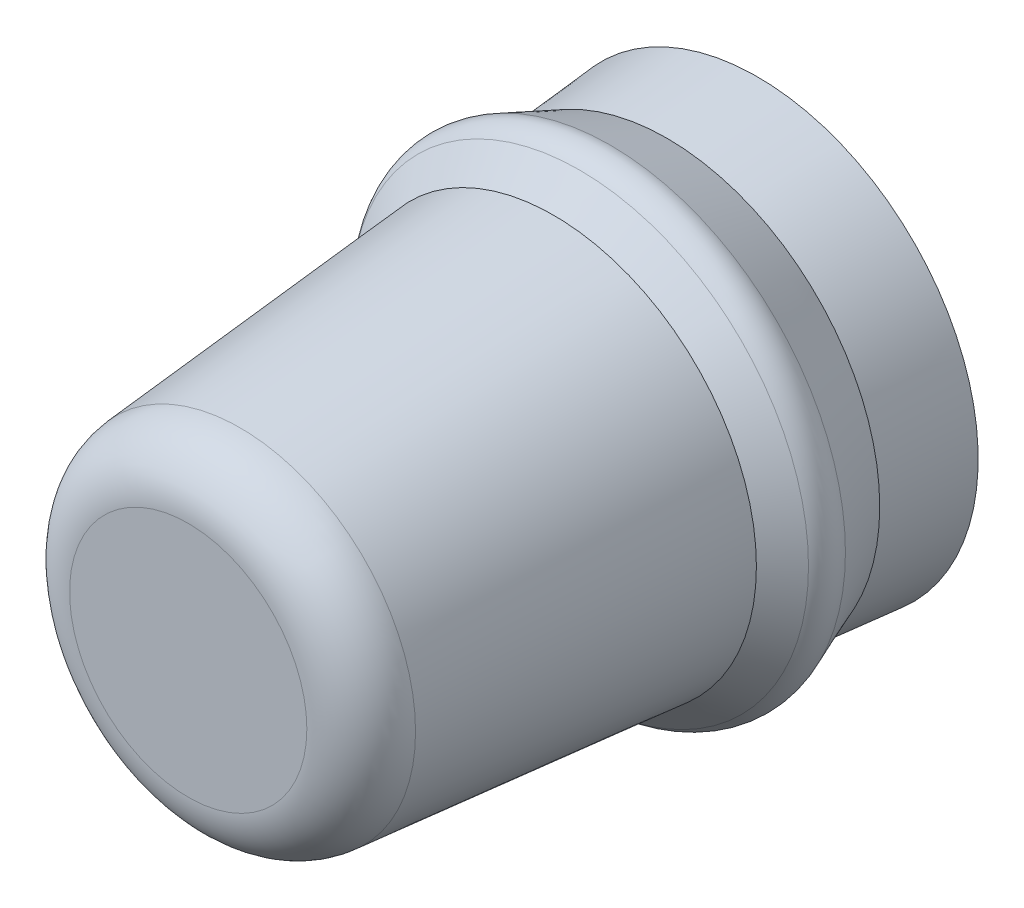
from build123d import *

# Parameters (mm, degrees)
SKETCH1_W       = 2
SKETCH1_H       = 5
CHAMFER1_SIZE   = 5.715026151
CHAMFER1_SIZE_2 = 0.5
FILLET1_R       = 0.5
FILLET2_R       = 0.25


with BuildPart() as part:
    # Sketch1 → Revolve1 (revolve)
    with BuildSketch(Plane.YZ, mode=Mode.PRIVATE) as revolve1_sk:
        with Locations((1, 2.5)):
            Rectangle(SKETCH1_W, SKETCH1_H)
    revolve(revolve1_sk.sketch.rotate(Axis((0, 0, 0), (0, 0, 1)), 90), axis=Axis((0, 0, 0), (0, 0, 1)))

    # Chamfer1
    # the kernel refuses this chamfer: 5.715026151, 0.5 mm, written as the material it takes off along each edge
    with BuildSketch(Plane(origin=(0, 0, 5), x_dir=(-1, 0, 0), z_dir=(0, 1, 0))) as chamfer1_piece_1:
        Polygon((2, -CHAMFER1_SIZE), (2 - CHAMFER1_SIZE_2, 0), (2, 0), align=None)
    revolve(axis=Axis((0, 0, 5), (0, 0, 1)), mode=Mode.SUBTRACT)

    # Fillet1
    fillet1_edges = [part.edges().sort_by_distance(p)[0] for p in [
        (1.5, 0, 5),
    ]]
    fillet(fillet1_edges, radius=FILLET1_R)

    # Sketch2 → Revolve3 (revolve)
    with BuildSketch(Plane.YZ, mode=Mode.PRIVATE) as revolve3_sk:
        Polygon((1.867885288, 0.795051912), (2.125603865, 1.446129176), (1.780752855, 1.790980186), align=None)
    revolve(revolve3_sk.sketch.rotate(Axis((0, 0, 0), (0, 0, 1)), 90), axis=Axis((0, 0, 0), (0, 0, 1)))

    # Fillet2
    fillet2_edges = [part.edges().sort_by_distance(p)[0] for p in [
        (2.125603865, 0, 1.446129176),
    ]]
    fillet(fillet2_edges, radius=FILLET2_R)


solid = part.part
